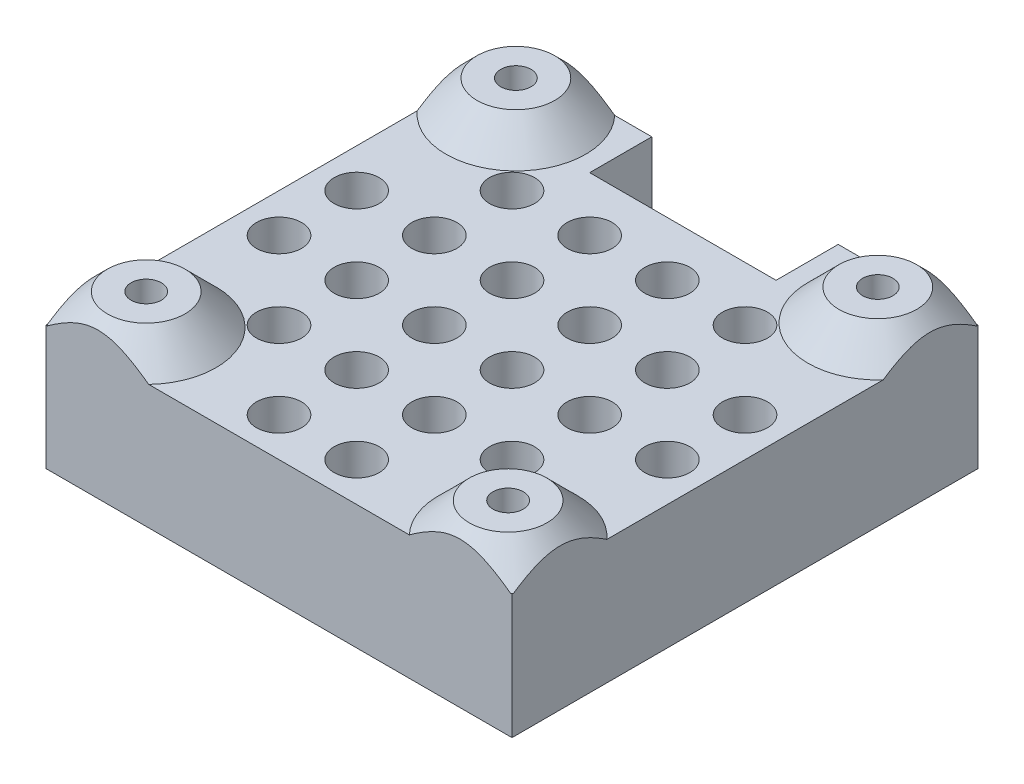
from build123d import *

# Parameters (mm, degrees)
SKETCH1_W                = 30
SKETCH1_H                = 30
BOSS_EXTRUDE1_DEPTH      = 8
SKETCH5_R                = 1.45
CUT_EXTRUDE3_DEPTH       = 23.671568098
LPATTERN1_COUNT          = 6
LPATTERN1_PITCH          = 5
LPATTERN1_COUNT_DIR2     = 6
LPATTERN1_PITCH_DIR2     = 5
BOSS_EXTRUDE2_DEPTH      = 2
BOSS_EXTRUDE2_DEPTH_BACK = 8
SKETCH2_R                = 2.5
SKETCH3_R                = 0.975
CUT_EXTRUDE1_DEPTH       = 24.452078799
SKETCH4_W                = 12
SKETCH4_H                = 4
CUT_EXTRUDE2_DEPTH       = 23.671568098
CHAMFER1_SIZE            = 2


with BuildPart() as part:
    # Sketch1 → Boss-Extrude1 (new body)
    with BuildSketch(Plane(origin=(0, 0, 0), x_dir=(1, 0, 0), z_dir=(0, 1, 0))):
        Rectangle(SKETCH1_W, SKETCH1_H)
    extrude(amount=BOSS_EXTRUDE1_DEPTH)

    # Sketch5 → Cut-Extrude3 (cut, through all)
    with BuildSketch(Plane.XZ):
        with Locations(Location((-12.5, 12.5, 0), (0, 0, 270))):
            Circle(SKETCH5_R)
    cut_extrude3 = extrude(amount=-CUT_EXTRUDE3_DEPTH, mode=Mode.SUBTRACT)

    # LPattern1: Cut-Extrude3 6 × 6, 10 skipped
    with Locations(*[(i * LPATTERN1_PITCH, 0, -j * LPATTERN1_PITCH_DIR2) for i in range(LPATTERN1_COUNT) for j in range(LPATTERN1_COUNT_DIR2) if (i, j) not in ((0, 0), (0, 1), (0, 4), (1, 0), (1, 5), (2, 5), (3, 5), (4, 0), (4, 5), (5, 1), (5, 4))]):
        add(cut_extrude3, mode=Mode.SUBTRACT)

    # Sketch2 → Boss-Extrude2 (add, two sides: drawn at the far end of the back side and taken through both)
    with BuildSketch(Plane(origin=(0, 8, 0), x_dir=(1, 0, 0), z_dir=(0, 1, 0)).offset(-BOSS_EXTRUDE2_DEPTH_BACK)):
        with Locations(Location((-11.65, 11.9, 0), (0, 0, 270))):
            Circle(SKETCH2_R)
        with Locations(Location((11.65, 11.9, 0), (0, 0, 270))):
            Circle(SKETCH2_R)
        with Locations(Location((11.65, -11.9, 0), (0, 0, 270))):
            Circle(SKETCH2_R)
        with Locations(Location((-11.65, -11.9, 0), (0, 0, 270))):
            Circle(SKETCH2_R)
    extrude(amount=BOSS_EXTRUDE2_DEPTH + BOSS_EXTRUDE2_DEPTH_BACK)

    # Sketch3 → Cut-Extrude1 (cut, through all)
    with BuildSketch(Plane(origin=(0, 10, 0), x_dir=(1, 0, 0), z_dir=(0, 1, 0))):
        with Locations(Location((-11.65, 11.9, 0), (0, 0, 270))):
            Circle(SKETCH3_R)
        with Locations(Location((11.65, 11.9, 0), (0, 0, 270))):
            Circle(SKETCH3_R)
        with Locations(Location((-11.65, -11.9, 0), (0, 0, 270))):
            Circle(SKETCH3_R)
        with Locations(Location((11.65, -11.9, 0), (0, 0, 270))):
            Circle(SKETCH3_R)
    extrude(amount=-CUT_EXTRUDE1_DEPTH, mode=Mode.SUBTRACT)

    # Sketch4 → Cut-Extrude2 (cut, through all)
    with BuildSketch(Plane(origin=(0, 8, 0), x_dir=(1, 0, 0), z_dir=(0, 1, 0))):
        with Locations((0, 13)):
            Rectangle(SKETCH4_W, SKETCH4_H)
    extrude(amount=-CUT_EXTRUDE2_DEPTH, mode=Mode.SUBTRACT)

    # Chamfer1
    # the kernel refuses this chamfer: 2 mm, written as the material it adds along each edge
    with BuildSketch(Plane(origin=(-11.65, 8, -11.9), x_dir=(0, 0, 1), z_dir=(-1, 0, 0))) as chamfer1_piece_1_section:
        Polygon((2.5 + CHAMFER1_SIZE, 0), (2.5, CHAMFER1_SIZE), (2.5, 0), align=None)
    chamfer1_piece_1 = revolve(axis=Axis((-11.65, 8, -11.9), (0, 1, 0)), mode=Mode.PRIVATE)
    chamfer1_piece_1 = split(chamfer1_piece_1, bisect_by=Plane(origin=(-8.021209726, 8.262551845, -15), z_dir=(0, 0, 1)), keep=Keep.TOP, mode=Mode.PRIVATE)
    chamfer1_piece_1 = split(chamfer1_piece_1, bisect_by=Plane(origin=(-15, 8.262551845, -9.804916959), z_dir=(1, 0, 0)), keep=Keep.TOP, mode=Mode.PRIVATE)
    chamfer1_piece_1 = split(chamfer1_piece_1, bisect_by=Plane(origin=(-8.021209726, 10, -9.804916959), z_dir=(0, -1, 0)), keep=Keep.TOP, mode=Mode.PRIVATE)
    add(chamfer1_piece_1)
    with BuildSketch(Plane(origin=(11.65, 8, -11.9), x_dir=(0, 0, 1), z_dir=(-1, 0, 0))) as chamfer1_piece_2_section:
        Polygon((2.5 + CHAMFER1_SIZE, 0), (2.5, CHAMFER1_SIZE), (2.5, 0), align=None)
    chamfer1_piece_2 = revolve(axis=Axis((11.65, 8, -11.9), (0, 1, 0)), mode=Mode.PRIVATE)
    chamfer1_piece_2 = split(chamfer1_piece_2, bisect_by=Plane(origin=(15, 8.948074694, -10.147678382), z_dir=(-1, 0, 0)), keep=Keep.TOP, mode=Mode.PRIVATE)
    chamfer1_piece_2 = split(chamfer1_piece_2, bisect_by=Plane(origin=(14.685110074, 8.948074694, -15), z_dir=(0, 0, 1)), keep=Keep.TOP, mode=Mode.PRIVATE)
    chamfer1_piece_2 = split(chamfer1_piece_2, bisect_by=Plane(origin=(14.685110074, 10, -10.147678382), z_dir=(0, -1, 0)), keep=Keep.TOP, mode=Mode.PRIVATE)
    add(chamfer1_piece_2)
    with BuildSketch(Plane(origin=(11.65, 8, 11.9), x_dir=(0, 0, 1), z_dir=(-1, 0, 0))) as chamfer1_piece_3_section:
        Polygon((2.5 + CHAMFER1_SIZE, 0), (2.5, CHAMFER1_SIZE), (2.5, 0), align=None)
    chamfer1_piece_3 = revolve(axis=Axis((11.65, 8, 11.9), (0, 1, 0)), mode=Mode.PRIVATE)
    chamfer1_piece_3 = split(chamfer1_piece_3, bisect_by=Plane(origin=(11.65, 8.948074692, 15), z_dir=(0, 0, -1)), keep=Keep.TOP, mode=Mode.PRIVATE)
    chamfer1_piece_3 = split(chamfer1_piece_3, bisect_by=Plane(origin=(15, 8.948074692, 8.395356766), z_dir=(-1, 0, 0)), keep=Keep.TOP, mode=Mode.PRIVATE)
    chamfer1_piece_3 = split(chamfer1_piece_3, bisect_by=Plane(origin=(11.65, 10, 8.395356766), z_dir=(0, -1, 0)), keep=Keep.TOP, mode=Mode.PRIVATE)
    add(chamfer1_piece_3)
    with BuildSketch(Plane(origin=(-11.65, 8, 11.9), x_dir=(0, 0, 1), z_dir=(-1, 0, 0))) as chamfer1_piece_4_section:
        Polygon((2.5 + CHAMFER1_SIZE, 0), (2.5, CHAMFER1_SIZE), (2.5, 0), align=None)
    chamfer1_piece_4 = revolve(axis=Axis((-11.65, 8, 11.9), (0, 1, 0)), mode=Mode.PRIVATE)
    chamfer1_piece_4 = split(chamfer1_piece_4, bisect_by=Plane(origin=(-15, 8.948074692, 8.395356766), z_dir=(1, 0, 0)), keep=Keep.TOP, mode=Mode.PRIVATE)
    chamfer1_piece_4 = split(chamfer1_piece_4, bisect_by=Plane(origin=(-11.65, 8.948074692, 15), z_dir=(0, 0, -1)), keep=Keep.TOP, mode=Mode.PRIVATE)
    chamfer1_piece_4 = split(chamfer1_piece_4, bisect_by=Plane(origin=(-11.65, 10, 8.395356766), z_dir=(0, -1, 0)), keep=Keep.TOP, mode=Mode.PRIVATE)
    add(chamfer1_piece_4)


solid = part.part
